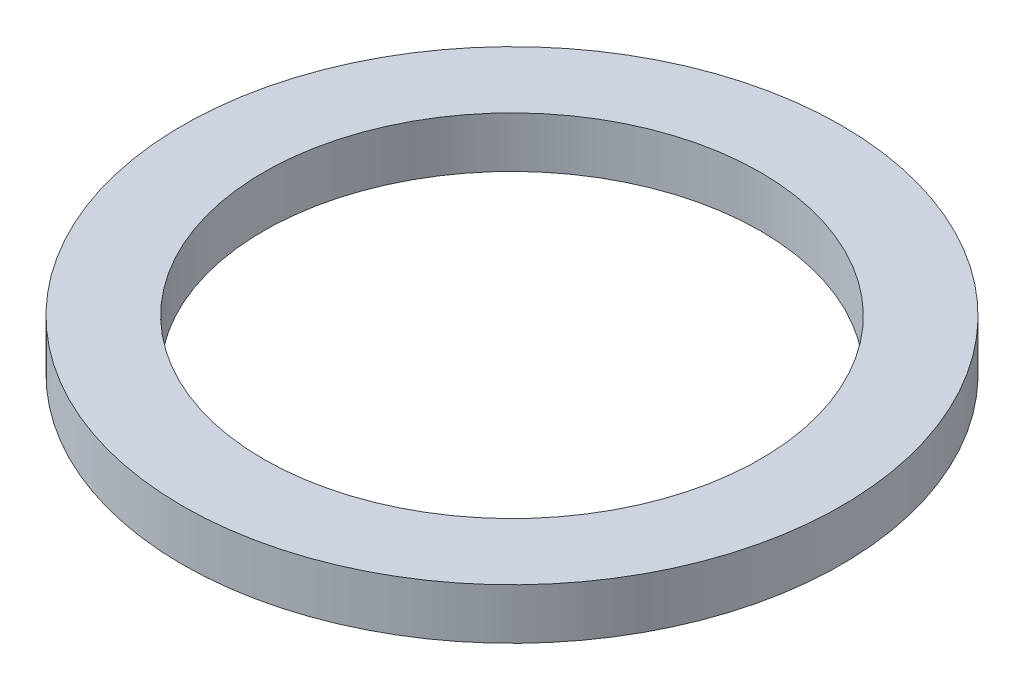
from build123d import *

# Parameters (mm, degrees)
SKETCH1_R           = 32.5
SKETCH1_R_2         = 24.5
BOSS_EXTRUDE1_DEPTH = 5


with BuildPart() as part:
    # Sketch1 → Boss-Extrude1 (new body)
    with BuildSketch(Plane(origin=(0, 0, 0), x_dir=(1, 0, 0), z_dir=(0, 1, 0))):
        Circle(SKETCH1_R)
        Circle(SKETCH1_R_2, mode=Mode.SUBTRACT)
    extrude(amount=BOSS_EXTRUDE1_DEPTH)


solid = part.part
